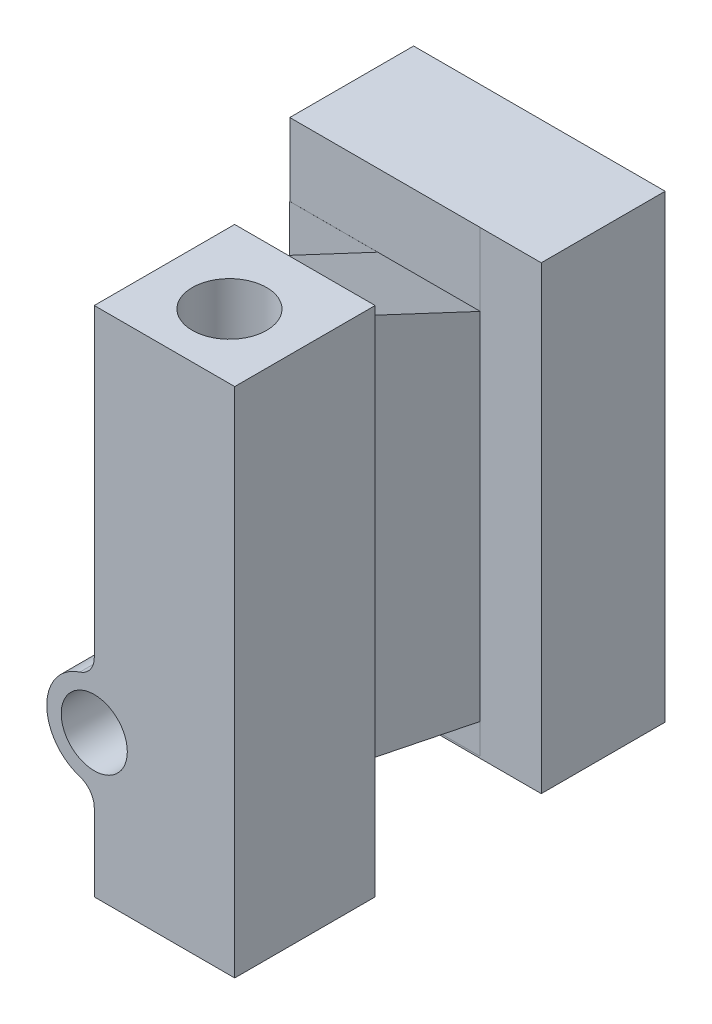
from build123d import *

# Parameters (mm, degrees)
SKETCH1_W           = 34
SKETCH1_H           = 124
BOSS_EXTRUDE1_DEPTH = 34
SKETCH2_R           = 11.504012884
BOSS_EXTRUDE2_DEPTH = 34
FILLET1_R           = 5
SKETCH3_R           = 13.586232418
CUT_EXTRUDE1_DEPTH  = 50
SKETCH4_R           = 8
CUT_EXTRUDE2_DEPTH  = 20
SKETCH5_W           = 24.830906905
SKETCH5_H           = 111.203932215
BOSS_EXTRUDE3_DEPTH = 30
SKETCH6_W           = 60.899939779
SKETCH6_H           = 111.310961987
BOSS_EXTRUDE4_DEPTH = 30
SKETCH7_R           = 8.998724885
CUT_EXTRUDE3_DEPTH  = 100
CUT_EXTRUDE5_DEPTH  = 100


with BuildPart() as part:
    # Sketch1 → Boss-Extrude1 (new body)
    with BuildSketch(Plane.XY):
        with Locations((-5.18125, -12.690625)):
            Rectangle(SKETCH1_W, SKETCH1_H)
    extrude(amount=BOSS_EXTRUDE1_DEPTH)

    # Sketch2 → Boss-Extrude2 (add)
    with BuildSketch(Plane.XY.offset(34)):
        with Locations((-22.18125, -40.250791069)):
            Circle(SKETCH2_R)
    extrude(amount=-BOSS_EXTRUDE2_DEPTH)

    # Fillet1
    fillet1_edges = [part.edges().sort_by_distance(p)[0] for p in [
        (-22.18125, -51.754803953, 17),
        (-22.18125, -28.746778185, 17),
    ]]
    fillet(fillet1_edges, radius=FILLET1_R)

    # Sketch3 → Cut-Extrude1 (cut)
    with BuildSketch(Plane.XZ.offset(74.690625)):
        with Locations((-4.893604294, 17.106225038)):
            Circle(SKETCH3_R)
    extrude(amount=-CUT_EXTRUDE1_DEPTH, mode=Mode.SUBTRACT)

    # Sketch4 → Cut-Extrude2 (cut)
    with BuildSketch(Plane.XY.offset(34)):
        with Locations((-22.18125, -40.250791069)):
            Circle(SKETCH4_R)
    extrude(amount=-CUT_EXTRUDE2_DEPTH, mode=Mode.SUBTRACT)

    # Sketch5 → Boss-Extrude3 (add)
    with BuildSketch(Plane(origin=(0, 0, 0), x_dir=(-1, 0, 0), z_dir=(0, 0, -1))):
        with Locations((5.153648801, -6.911017359)):
            Rectangle(SKETCH5_W, SKETCH5_H)
    extrude(amount=BOSS_EXTRUDE3_DEPTH)

    # Sketch6 → Boss-Extrude4 (add)
    with BuildSketch(Plane(origin=(0, 0, -30), x_dir=(-1, 0, 0), z_dir=(0, 0, -1))):
        with Locations((8.418056821, -7.285621558)):
            Rectangle(SKETCH6_W, SKETCH6_H)
    extrude(amount=BOSS_EXTRUDE4_DEPTH)

    # Sketch7 → Cut-Extrude3 (cut)
    with BuildSketch(Plane(origin=(0, 49.309375, 0), x_dir=(1, 0, 0), z_dir=(0, 1, 0))):
        with Locations((-5.091502482, -18.358859801)):
            Circle(SKETCH7_R)
    extrude(amount=-CUT_EXTRUDE3_DEPTH, mode=Mode.SUBTRACT)

    # Sketch9 → Cut-Extrude5 (cut)
    with BuildSketch(Plane(origin=(7.261804652, 0, 0), x_dir=(0, 0, -1), z_dir=(1, 0, 0))):
        Polygon((-0.011900431, 53.158400833), (-0.011900431, 44.862473141), (30.018715365, 30.783528167), (30.018715365, 53.158400833), align=None)
        Polygon((-0.011900431, -49.028418821), (-0.011900431, -66.373805341), (29.994778619, -69.28142928), (29.994778619, -55.173209223), align=None)
    extrude(amount=-CUT_EXTRUDE5_DEPTH, mode=Mode.SUBTRACT)


solid = part.part
